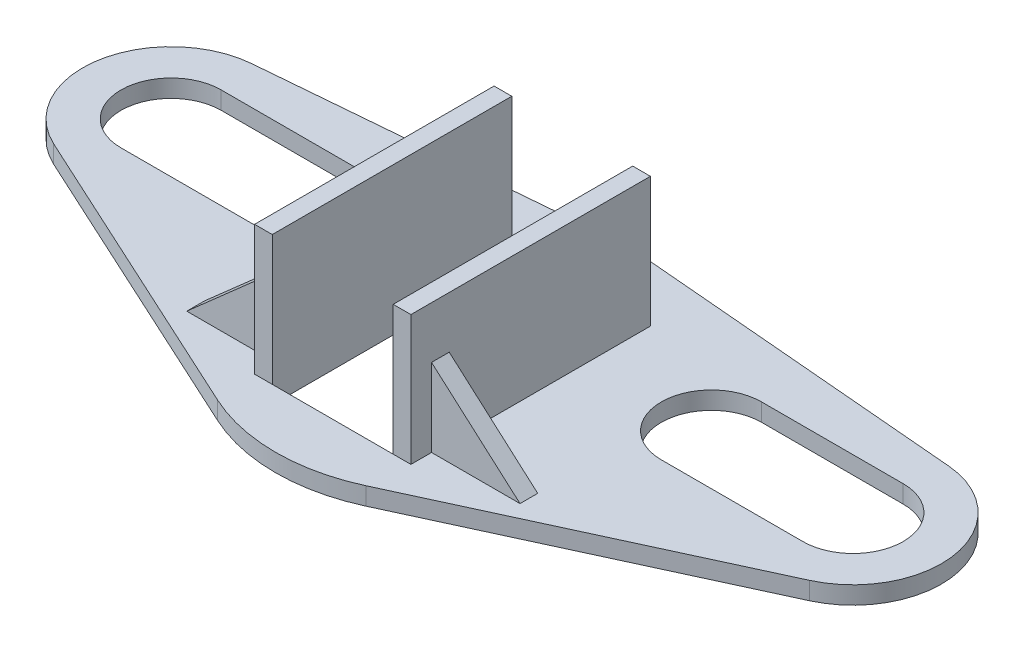
from build123d import *

# Parameters (mm, degrees)
SKETCH1_W           = 20.5
SKETCH1_H           = 40.6
BOSS_EXTRUDE1_DEPTH = 3
SKETCH2_W           = 3
SKETCH2_H           = 40.6
BOSS_EXTRUDE2_DEPTH = 22
RIB1_REACH          = 91.314
SKETCH3_WALL_W      = 200.627321538
SKETCH3_WALL_H      = 3


with BuildPart() as part:
    # Sketch1 → Boss-Extrude1 (new body)
    with BuildSketch(Plane(origin=(0, 0, 0), x_dir=(1, 0, 0), z_dir=(0, 1, 0))):
        with BuildLine():
            Line((-59.081204936, 25.045183636), (-2.562409871, 29.890367272))
            ThreePointArc((-2.562409871, 29.890367272), (0, 30), (2.562409871, 29.890367272))
            Line((2.562409871, 29.890367272), (59.081204936, 25.045183636))
            ThreePointArc((59.081204936, 25.045183636), (72.576107659, 12.68198421), (64.073582522, -3.525056416))
            Line((64.073582522, -3.525056416), (12.547165045, -27.250112832))
            ThreePointArc((12.547165045, -27.250112832), (0, -30), (-12.547165045, -27.250112832))
            Line((-12.547165045, -27.250112832), (-64.073582522, -3.525056416))
            ThreePointArc((-64.073582522, -3.525056416), (-72.576107659, 12.68198421), (-59.081204936, 25.045183636))
        make_face()
        Rectangle(SKETCH1_W, SKETCH1_H, mode=Mode.SUBTRACT)
        with BuildLine():
            Line((-57.8, 18.6), (-33.8, 18.6))
            ThreePointArc((-33.8, 18.6), (-25.3, 10.1), (-33.8, 1.6))
            Line((-33.8, 1.6), (-57.8, 1.6))
            ThreePointArc((-57.8, 1.6), (-66.3, 10.1), (-57.8, 18.6))
        make_face(mode=Mode.SUBTRACT)
        with BuildLine():
            Line((33.8, 18.6), (57.8, 18.6))
            ThreePointArc((57.8, 18.6), (66.3, 10.1), (57.8, 1.6))
            Line((57.8, 1.6), (33.8, 1.6))
            ThreePointArc((33.8, 1.6), (25.3, 10.1), (33.8, 18.6))
        make_face(mode=Mode.SUBTRACT)
    extrude(amount=BOSS_EXTRUDE1_DEPTH)

    # Sketch2 → Boss-Extrude2 (add)
    with BuildSketch(Plane(origin=(0, 3, 0), x_dir=(1, 0, 0), z_dir=(0, 1, 0))):
        with Locations((-11.75, 0)):
            Rectangle(SKETCH2_W, SKETCH2_H)
        with Locations((11.75, 0)):
            Rectangle(SKETCH2_W, SKETCH2_H)
    extrude(amount=BOSS_EXTRUDE2_DEPTH)

    # Sketch3 wall → Rib1 (add, up to next)
    with BuildSketch(Plane(origin=(20.75, 9.614378278, 15.3), x_dir=(0.750000000008, -0.661437827757, 0), z_dir=(0.661437827757, 0.750000000008, 0)), mode=Mode.PRIVATE) as rib1_sk1:
        Rectangle(SKETCH3_WALL_W, SKETCH3_WALL_H)
    rib1_tool1 = extrude(rib1_sk1.sketch, amount=-RIB1_REACH, mode=Mode.PRIVATE) - part.part
    rib1 = rib1_tool1.solids().sort_by_distance((20.75, 9.614378278, 15.3))[0]
    add(rib1)

    # Mirror1: Rib1 across plane
    add(rib1.mirror(Plane(origin=(0, 0, 0), x_dir=(0, 0, 1), z_dir=(1, 0, 0))))


solid = part.part
